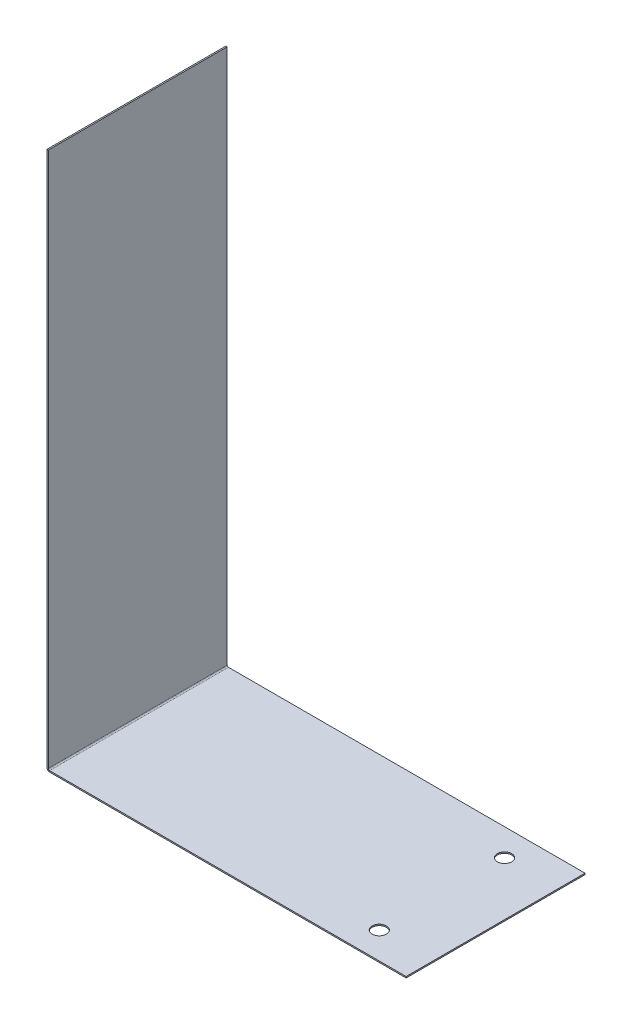
from build123d import *

# Parameters (mm, degrees)
BASE_FLANGE1_DEPTH = 100
SKETCH6_R          = 4
CUT_EXTRUDE1_DEPTH = 10


# Sheet-metal steps are written as plain solids
with BuildPart() as part:
    # Sketch1 → Base-Flange1 (new body)
    with BuildSketch(Plane.XY):
        with BuildLine():
            Line((0, 300), (0, 0.7366))
            ThreePointArc((0, 0.7366), (0.215745145, 0.215745145), (0.7366, 0))
            Line((0.7366, 0), (200, 0))
            Line((200, 0), (200, -0.7366))
            Line((200, -0.7366), (0.7366, -0.7366))
            ThreePointArc((0.7366, -0.7366), (-0.30510971, -0.30510971), (-0.7366, 0.7366))
            Line((-0.7366, 0.7366), (-0.7366, 300))
            Line((-0.7366, 300), (0, 300))
        make_face()
    extrude(amount=BASE_FLANGE1_DEPTH)

    # Sketch6 → Cut-Extrude1 (cut)
    with BuildSketch(Plane(origin=(0, 0, 0), x_dir=(1, 0, 0), z_dir=(0, 1, 0))):
        with Locations(Location((170, -15, 0), (0, 0, 270))):
            Circle(SKETCH6_R)
        with Locations(Location((170, -85, 0), (0, 0, 270))):
            Circle(SKETCH6_R)
    extrude(amount=-CUT_EXTRUDE1_DEPTH, mode=Mode.SUBTRACT)


solid = part.part
